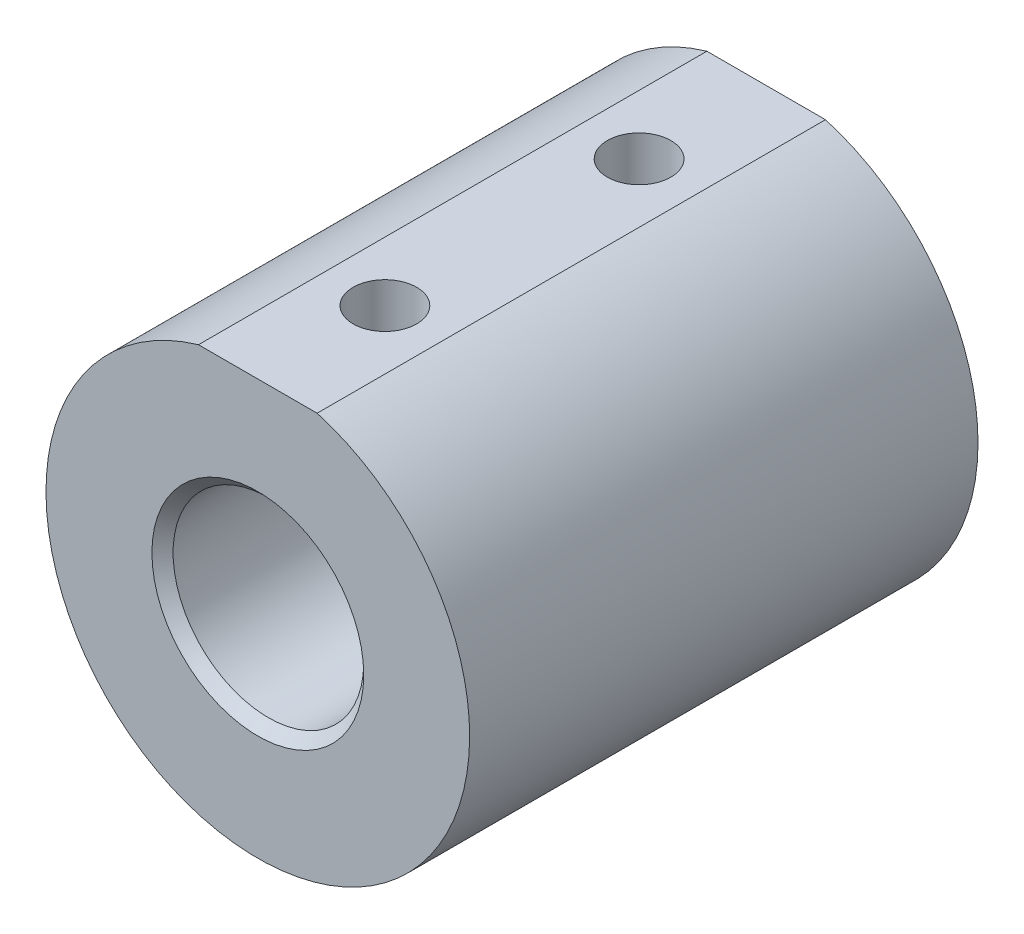
from build123d import *

# Parameters (mm, degrees)
SKETCH1_R           = 14.2875
BOSS_EXTRUDE1_DEPTH = 76.2
CUT_EXTRUDE1_REACH  = 105.378
SKETCH2_R           = 4.7625
CHAMFER1_SIZE       = 1.5875


with BuildPart() as part:
    # Sketch1 → Boss-Extrude1 (new body)
    with BuildSketch(Plane.XY):
        with BuildLine():
            Line((8.89, 30.48), (-8.89, 30.48))
            ThreePointArc((-8.89, 30.48), (-19.05, -25.4), (31.75, 0))
            ThreePointArc((31.75, 0), (25.4, 19.05), (8.89, 30.48))
        make_face()
        Circle(SKETCH1_R, mode=Mode.SUBTRACT)
    extrude(amount=BOSS_EXTRUDE1_DEPTH)

    # Sketch2 → Cut-Extrude1 (cut, up to next)
    with BuildSketch(Plane(origin=(0, 30.48, 0), x_dir=(1, 0, 0), z_dir=(0, 1, 0)), mode=Mode.PRIVATE) as cut_extrude1_sk1:
        with Locations((0, -57.15)):
            Circle(SKETCH2_R)
    cut_extrude1_tool1 = extrude(cut_extrude1_sk1.sketch, amount=-CUT_EXTRUDE1_REACH, mode=Mode.PRIVATE) & part.part
    # Sketch2 → Cut-Extrude1 (cut, up to next)
    with BuildSketch(Plane(origin=(0, 30.48, 0), x_dir=(1, 0, 0), z_dir=(0, 1, 0)), mode=Mode.PRIVATE) as cut_extrude1_sk2:
        with Locations((0, -19.05)):
            Circle(SKETCH2_R)
    cut_extrude1_tool2 = extrude(cut_extrude1_sk2.sketch, amount=-CUT_EXTRUDE1_REACH, mode=Mode.PRIVATE) & part.part
    add(cut_extrude1_tool1.solids().sort_by_distance((0, 30.48, 57.15))[0], mode=Mode.SUBTRACT)
    add(cut_extrude1_tool2.solids().sort_by_distance((0, 30.48, 19.05))[0], mode=Mode.SUBTRACT)

    # Chamfer1
    chamfer1_edges = [part.edges().sort_by_distance(p)[0] for p in [
        (-14.2875, 0, 0),
        (-14.2875, 0, 76.2),
    ]]
    chamfer(chamfer1_edges, length=CHAMFER1_SIZE)


solid = part.part
